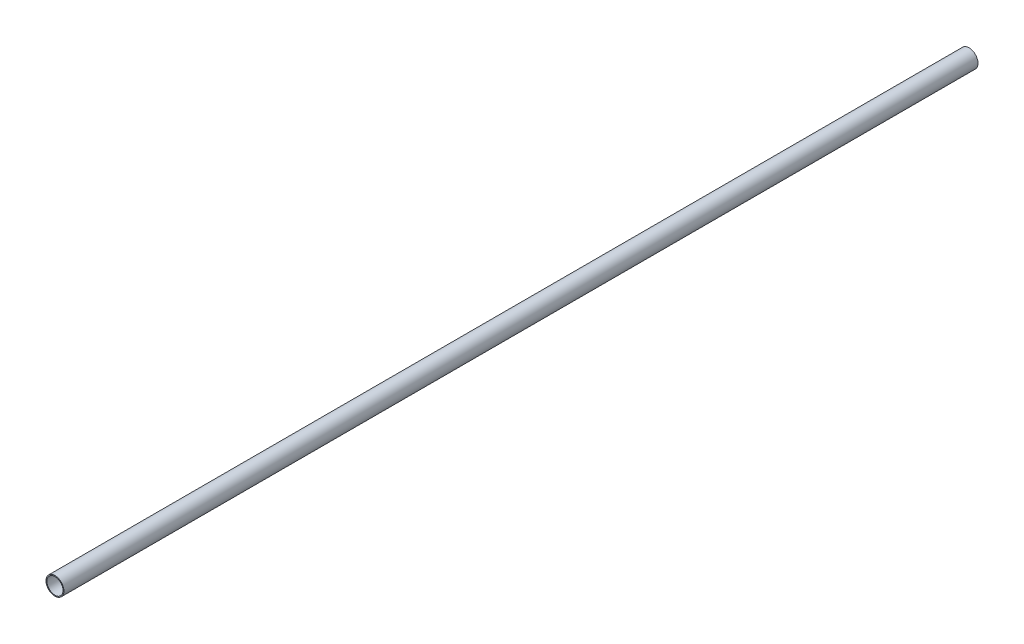
from build123d import *

# Parameters (mm, degrees)
BOSS_EXTRUDE1_DEPTH      = 311.15
BOSS_EXTRUDE1_DEPTH_BACK = 12.7
SKETCH1_R                = 3.175
SKETCH1_R_2              = 2.8575


with BuildPart() as part:
    # Sketch1 → Boss-Extrude1 (new, two sides: drawn at the far end of the back side and taken through both)
    with BuildSketch(Plane.XY.offset(-BOSS_EXTRUDE1_DEPTH_BACK)):
        with Locations((3.736791918, 0.743294127)):
            Circle(SKETCH1_R)
        with Locations((3.736791918, 0.743294127)):
            Circle(SKETCH1_R_2, mode=Mode.SUBTRACT)
    extrude(amount=BOSS_EXTRUDE1_DEPTH + BOSS_EXTRUDE1_DEPTH_BACK)


solid = part.part
